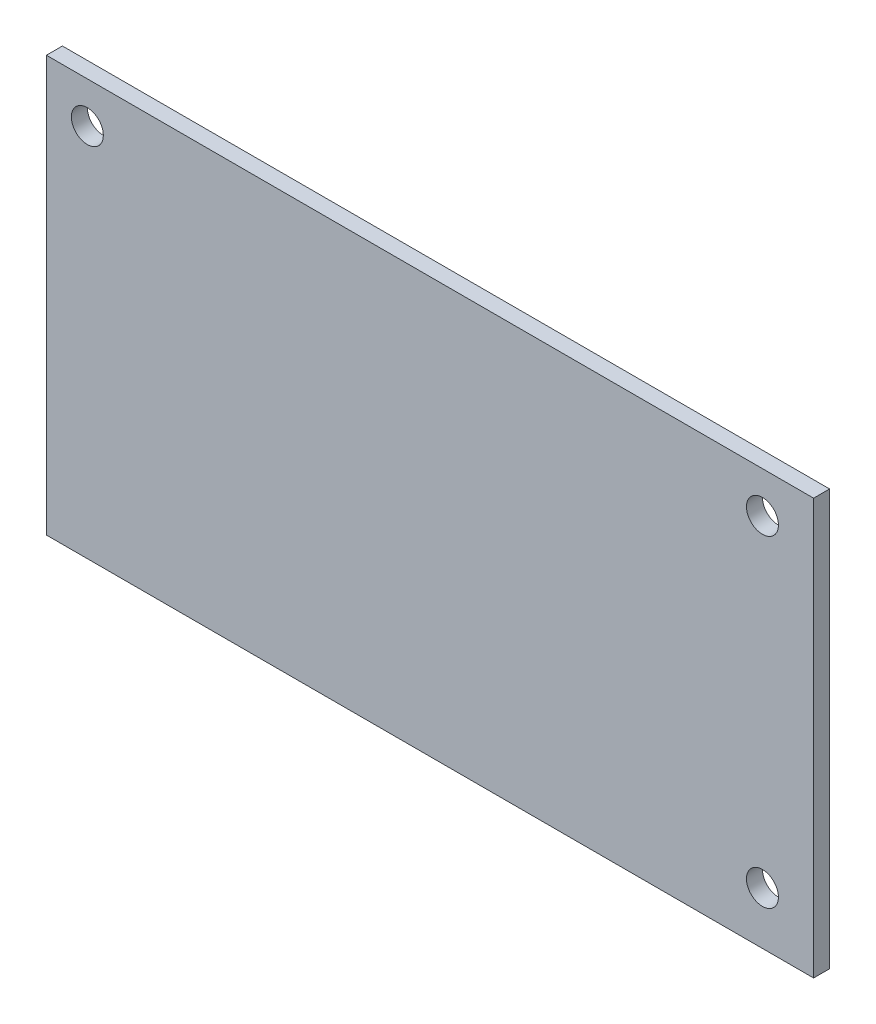
from build123d import *

# Parameters (mm, degrees)
SKETCH1_W           = 76.2
SKETCH1_H           = 41.275
SKETCH1_R           = 1.5875
BOSS_EXTRUDE1_DEPTH = 1.5875


with BuildPart() as part:
    # Sketch1 → Boss-Extrude1 (new body)
    with BuildSketch(Plane.XY):
        with Locations((38.1, 20.6375)):
            Rectangle(SKETCH1_W, SKETCH1_H)
        with Locations((4.064, 37.211)):
            Circle(SKETCH1_R, mode=Mode.SUBTRACT)
        with Locations((71.12, 37.211)):
            Circle(SKETCH1_R, mode=Mode.SUBTRACT)
        with Locations((71.12, 5.207)):
            Circle(SKETCH1_R, mode=Mode.SUBTRACT)
    extrude(amount=BOSS_EXTRUDE1_DEPTH)


solid = part.part
